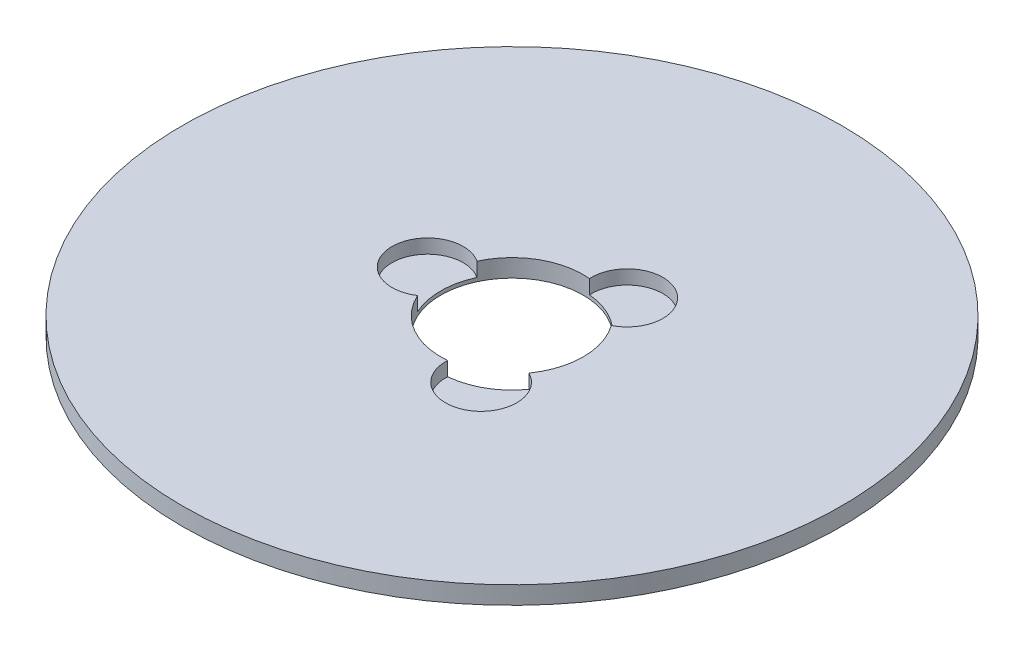
from build123d import *

# Parameters (mm, degrees)
SKETCH1_R           = 92.5
BOSS_EXTRUDE1_DEPTH = 5
SKETCH2_R           = 20
CUT_EXTRUDE1_DEPTH  = 131.910274616
SKETCH3_R           = 10
CUT_EXTRUDE2_DEPTH  = 3.950799967
CIRPATTERN1_COUNT   = 3


with BuildPart() as part:
    # Sketch1 → Boss-Extrude1 (new body)
    with BuildSketch(Plane(origin=(0, 0, 0), x_dir=(1, 0, 0), z_dir=(0, 1, 0))):
        Circle(SKETCH1_R)
    extrude(amount=BOSS_EXTRUDE1_DEPTH)

    # Sketch2 → Cut-Extrude1 (cut, through all)
    with BuildSketch(Plane(origin=(0, 0, 0), x_dir=(1, 0, 0), z_dir=(0, 1, 0))):
        Circle(SKETCH2_R)
    extrude(amount=CUT_EXTRUDE1_DEPTH, mode=Mode.SUBTRACT)

    # Sketch3 → Cut-Extrude2 (cut)
    with BuildSketch(Plane(origin=(0, 5, 0), x_dir=(1, 0, 0), z_dir=(0, 1, 0))):
        with Locations((-23.682025435, 0)):
            Circle(SKETCH3_R)
    cut_extrude2 = extrude(amount=-CUT_EXTRUDE2_DEPTH, mode=Mode.SUBTRACT)

    # CirPattern1: Cut-Extrude2 ×3 about axis
    cirpattern1_axis = Axis((0, 0, 0), (0, 1, 0))
    for i in range(1, CIRPATTERN1_COUNT):
        add(cut_extrude2.rotate(cirpattern1_axis, i * 360 / CIRPATTERN1_COUNT), mode=Mode.SUBTRACT)


solid = part.part
